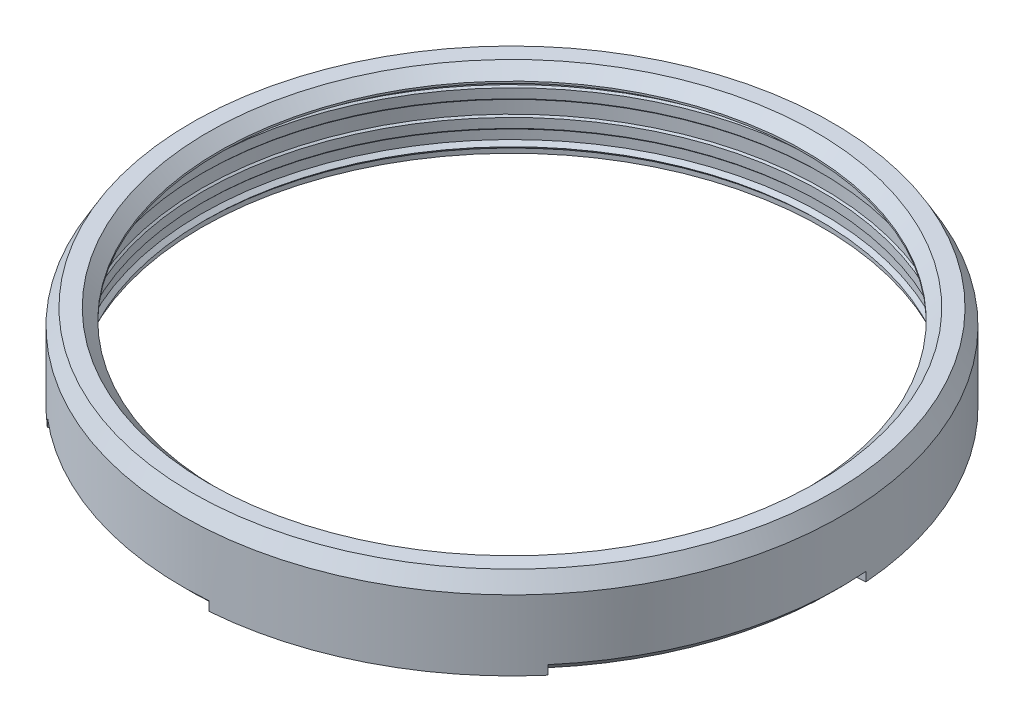
from build123d import *

# Parameters (mm, degrees)
SKETCH_1_R               = 36
EXTRUDE_1_DEPTH          = 2.4
SKETCH_3_R               = 32
CUT_EXTRUDE_1_DEPTH      = 10
SKETCH_4_R               = 36
CUT_EXTRUDE_2_DEPTH      = 1
CHAMFER_3_SIZE           = 1.732
CHAMFER_3_SIZE2          = 0.999970666
CHAMFER_2_SIZE           = 1.2
CUT_REVOLVE_1_ANGLE      = 45
PATTERN_CIRCULAR_1_COUNT = 4


with BuildPart() as part:
    # 草图1 → 凸台-拉伸1 (new body)
    with BuildSketch(Plane(origin=(0, 0, 0), x_dir=(1, 0, 0), z_dir=(0, 1, 0))):
        Circle(SKETCH_1_R)
    extrude(amount=EXTRUDE_1_DEPTH)

    # 草图2 → 旋转1 (revolve)
    with BuildSketch(Plane.XY):
        with BuildLine():
            Line((33.94, -7.5), (33.94, -8))
            Line((33.94, -8), (36, -8))
            Line((36, -8), (36, 0))
            Line((36, 0), (32.44, 0))
            ThreePointArc((32.44, 0), (33.500660172, -0.439339828), (33.94, -1.5))
            Line((33.94, -1.5), (33.76, -1.68))
            Line((33.76, -1.68), (33.76, -2.72))
            Line((33.76, -2.72), (33.94, -2.9))
            Line((33.94, -2.9), (33.94, -4.3))
            Line((33.94, -4.3), (33.76, -4.48))
            Line((33.76, -4.48), (33.76, -5.52))
            Line((33.76, -5.52), (33.94, -5.7))
            Line((33.94, -5.7), (33.94, -6.7))
            Line((33.94, -6.7), (33.54, -7.1))
            Line((33.54, -7.1), (33.94, -7.5))
        make_face()
    revolve(axis=Axis((0, -23.4, 0), (0, 1, 0)))

    # 草图3 → 切除-拉伸1 (cut)
    with BuildSketch(Plane(origin=(0, 2.4, 0), x_dir=(1, 0, 0), z_dir=(0, 1, 0))):
        Circle(SKETCH_3_R)
    extrude(amount=-CUT_EXTRUDE_1_DEPTH, mode=Mode.SUBTRACT)

    # 草图4 → 切除-拉伸2 (cut)
    with BuildSketch(Plane(origin=(0, 2.4, 0), x_dir=(1, 0, 0), z_dir=(0, 1, 0))):
        Circle(SKETCH_4_R)
    extrude(amount=-CUT_EXTRUDE_2_DEPTH, mode=Mode.SUBTRACT)

    # 倒角3
    chamfer_3_edges = [part.edges().sort_by_distance(p)[0] for p in [
        (-36, 1.4, 0),
    ]]
    chamfer_3_side = [part.faces().sort_by_distance(p)[0] for p in [
        (-36, 0.7, 0),
    ]]
    chamfer(chamfer_3_edges, length=CHAMFER_3_SIZE, length2=CHAMFER_3_SIZE2, reference=chamfer_3_side[0])

    # 倒角2
    chamfer_2_edges = [part.edges().sort_by_distance(p)[0] for p in [
        (-32, 1.4, 0),
    ]]
    chamfer(chamfer_2_edges, length=CHAMFER_2_SIZE)

    # 草图6 → 切除-旋转1 (revolve, cut)
    with BuildSketch(Plane(origin=(0, 0, 0), x_dir=(0.9970124779095012, 0, -0.07724065569864448), z_dir=(0.07724065569864448, 0, 0.9970124779095012))):
        Polygon((-35, -8), (-36, -7), (-36, -8), align=None)
    cut_revolve_1 = revolve(axis=Axis((0, -23.4, 0), (0, -1, 0)), revolution_arc=CUT_REVOLVE_1_ANGLE, mode=Mode.SUBTRACT)

    # 阵列(圆周)1: 切除-旋转1 ×4 about axis
    pattern_circular_1_axis = Axis((0, -23.4, 0), (0, 1, 0))
    for i in range(1, PATTERN_CIRCULAR_1_COUNT):
        add(cut_revolve_1.rotate(pattern_circular_1_axis, i * 360 / PATTERN_CIRCULAR_1_COUNT), mode=Mode.SUBTRACT)


solid = part.part
